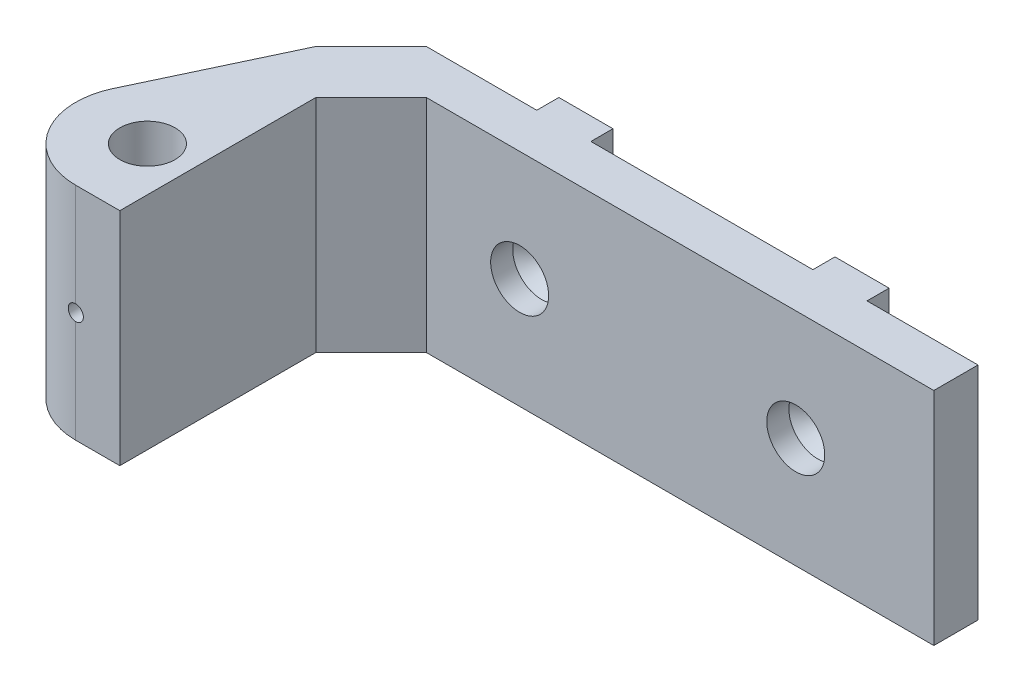
from build123d import *

# Parameters (mm, degrees)
SKETCH1_W               = 100
SKETCH1_H               = 40
SKETCH1_R               = 2.75
BOSS_EXTRUDE1_DEPTH     = 8
SKETCH2_R               = 5
BOSS_EXTRUDE2_DEPTH     = 40
BOSS_EXTRUDE3_START     = 4
SKETCH4_W               = 9.8
SKETCH4_H               = 40
SKETCH4_R               = 2.75
BOSS_EXTRUDE3_DEPTH     = 4
SKETCH5_R               = 5.25
CUT_EXTRUDE1_DEPTH      = 4
CHAMFER2_SIZE           = 2.5
CUT_EXTRUDE2_REACH      = 96.977
CUT_EXTRUDE2_END_RADIUS = 5
SKETCH6_R               = 1.4
BOSS_EXTRUDE4_DEPTH     = 40


# Some blends are built 0.0001 mm under size
with BuildPart() as part:
    # Sketch1 → Boss-Extrude1 (new body)
    with BuildSketch(Plane.XY):
        Rectangle(SKETCH1_W, SKETCH1_H)
        with Locations((-25, 0)):
            Circle(SKETCH1_R, mode=Mode.SUBTRACT)
        with Locations((25, 0)):
            Circle(SKETCH1_R, mode=Mode.SUBTRACT)
    extrude(amount=BOSS_EXTRUDE1_DEPTH)

    # Sketch2 → Boss-Extrude2 (add)
    with BuildSketch(Plane.XZ.offset(20)):
        with BuildLine():
            Line((-50, 0), (-59.9, 0))
            Line((-59.9, 0), (-59.9, 27.5))
            ThreePointArc((-59.9, 27.5), (-72.9, 40.5), (-59.9, 53.5))
            Line((-59.9, 53.5), (-51.9, 53.5))
            Line((-51.9, 53.5), (-51.9, 8))
            Line((-51.9, 8), (-50, 8))
            Line((-50, 8), (-50, 0))
        make_face()
        with Locations(Location((-59.9, 40.5, 0), (0, 0, 270))):
            Circle(SKETCH2_R, mode=Mode.SUBTRACT)
    extrude(amount=-BOSS_EXTRUDE2_DEPTH)

    # Chamfer1
    # the kernel refuses this chamfer: 10 mm, written as the material it adds along each edge
    with BuildSketch(Plane(origin=(-51.9, -20, 8), x_dir=(0.9996219169112968, 0, -0.027495876610586403), z_dir=(0, 1, 0))) as chamfer1_piece_1:
        with BuildLine():
            Line((10.286731952, 0), (-0.565471549, -10.271177935))
            Line((-0.565471549, -10.271177935), (-0.765395932, -10.26567876))
            ThreePointArc((-0.765395932, -10.26567876), (-0.341292271, -5.133978296), (-0.199924383, 0.005499175))
            Line((-0.199924383, 0.005499175), (0.005499175, 0.199924383))
            ThreePointArc((0.005499175, 0.199924383), (5.144976647, 0.058556496), (10.292231127, 0.199924383))
            Line((10.292231127, 0.199924383), (10.286731952, 0))
        make_face()
    extrude(amount=40)
    with BuildSketch(Plane(origin=(-59.9, -20, 27.5), x_dir=(-0.9634026382887829, 0, 0.26805849462050707), z_dir=(0, 1, 0))) as chamfer1_piece_2:
        with BuildLine():
            Line((6.087608123, 0), (-2.363030305, -7.699460597))
            Line((-2.363030305, -7.699460597), (-2.555710833, -7.645848898))
            ThreePointArc((-2.555710833, -7.645848898), (-1.271764875, -3.82461909), (-0.192680528, 0.053611699))
            Line((-0.192680528, 0.053611699), (0.053611699, 0.192680528))
            ThreePointArc((0.053611699, 0.192680528), (3.034373901, -0.267839497), (6.052113215, 0.196825079))
            Line((6.052113215, 0.196825079), (6.087608123, 0))
        make_face()
    extrude(amount=40)
    # the kernel refuses this chamfer: 10 mm, written as the material it takes off along each edge
    with BuildSketch(Plane(origin=(-59.9, -45.71682988, 0), x_dir=(-0.027495876610586324, 0, 0.9996219169112968), z_dir=(0, 1, 0))) as chamfer1_2_piece_1:
        with BuildLine():
            Line((10.286731952, 0), (-0.565471549, 10.271177935))
            Line((-0.565471549, 10.271177935), (-0.765395932, 10.26567876))
            ThreePointArc((-0.765395932, 10.26567876), (-0.341292271, 5.133978296), (-0.199924383, -0.005499175))
            Line((-0.199924383, -0.005499175), (0.005499175, -0.199924383))
            ThreePointArc((0.005499175, -0.199924383), (5.144976647, -0.058556496), (10.292231127, -0.199924383))
            Line((10.292231127, -0.199924383), (10.286731952, 0))
        make_face()
    extrude(amount=91.433659759, mode=Mode.SUBTRACT)

    # Sketch4 → Boss-Extrude3 (add)
    # profile 1 of 2: a face of its own
    with BuildSketch(Plane(origin=(0, 0, 0), x_dir=(-1, 0, 0), z_dir=(0, 0, -1)).offset(BOSS_EXTRUDE3_START)):
        with Locations((25, 0)):
            Rectangle(SKETCH4_W, SKETCH4_H)
        with Locations((25, 0)):
            Circle(SKETCH4_R, mode=Mode.SUBTRACT)
    # profile 2 of 2: a face of its own
    with BuildSketch(Plane(origin=(0, 0, 0), x_dir=(-1, 0, 0), z_dir=(0, 0, -1)).offset(BOSS_EXTRUDE3_START)):
        with Locations((-25, 0)):
            Rectangle(SKETCH4_W, SKETCH4_H)
        with Locations(Location((-25, 0, 0), (0, 0, 180))):
            Circle(SKETCH4_R, mode=Mode.SUBTRACT)
    extrude(amount=-BOSS_EXTRUDE3_DEPTH)

    # Sketch5 → Cut-Extrude1 (cut)
    with BuildSketch(Plane.XY.offset(8)):
        with Locations((25, 0)):
            Circle(SKETCH5_R)
        with Locations((-25, 0)):
            Circle(SKETCH5_R)
    extrude(amount=-CUT_EXTRUDE1_DEPTH, mode=Mode.SUBTRACT)

    # Chamfer2
    chamfer2_edges = [part.edges().sort_by_distance(p)[0] for p in [
        (22.25, 0, 4),
        (-27.75, 0, 4),
    ]]
    chamfer(chamfer2_edges, length=CHAMFER2_SIZE - 0.0001)  # a hair under: the kernel refuses the full size

    # Cut-Extrude2: up to this cylinder (the profile starts outside it)
    cut_extrude2_end = Plane(origin=(-59.9, 0, 40.5), z_dir=(0, -1, 0)) * Cylinder(CUT_EXTRUDE2_END_RADIUS, 204.954, mode=Mode.PRIVATE)
    # Sketch6 → Cut-Extrude2 (cut, up to the surface)
    with BuildSketch(Plane.XY.offset(53.5), mode=Mode.PRIVATE) as cut_extrude2_sk1:
        with Locations((-59.9, 0)):
            Circle(SKETCH6_R)
    cut_extrude2_tool1 = extrude(cut_extrude2_sk1.sketch, amount=-CUT_EXTRUDE2_REACH, mode=Mode.PRIVATE) - cut_extrude2_end
    add(cut_extrude2_tool1.solids().sort_by_distance((-59.9, 0, 53.5))[0], mode=Mode.SUBTRACT)

    # Sketch7 → Boss-Extrude4 (add)
    with BuildSketch(Plane.XZ.offset(20)):
        Polygon((-59.9, 10), (-71.659995777, 34.959016393), (-59.9, 34.959016393), align=None)
    extrude(amount=-BOSS_EXTRUDE4_DEPTH)


solid = part.part
